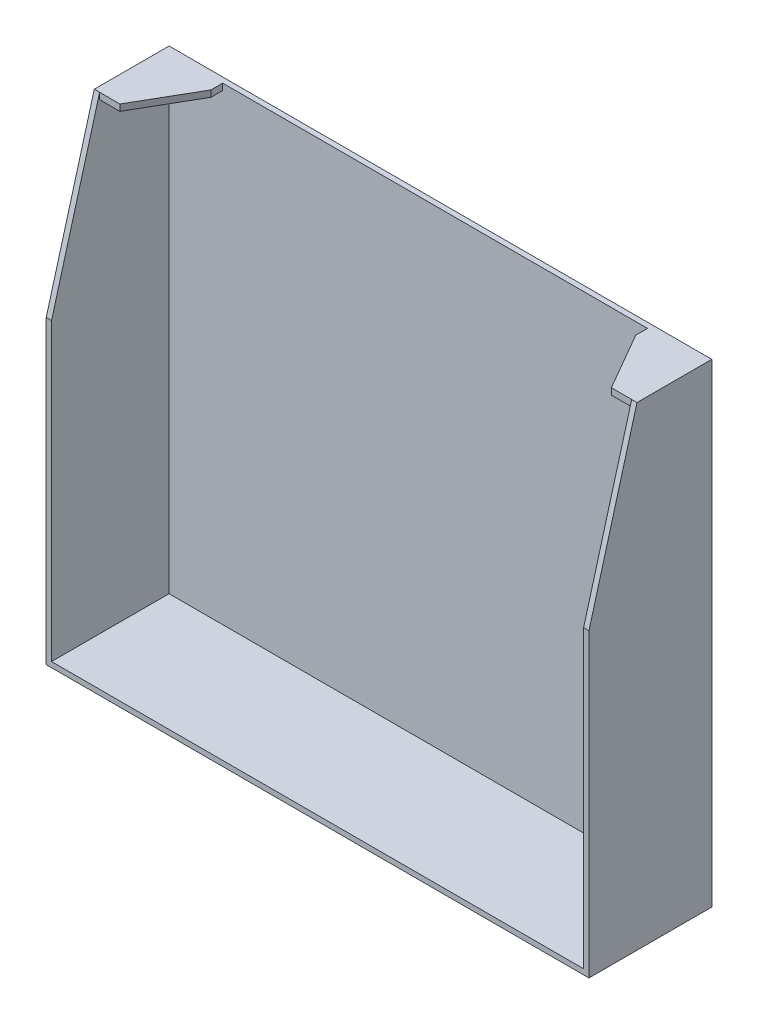
from build123d import *

# Parameters (mm, degrees)
SKETCH1_W              = 254
SKETCH1_H              = 222
BOSS_EXTRUDE1_DEPTH    = 2.5
BOSS_EXTRUDE2_DEPTH    = 55
HOLD_TAB_DEPTH         = 3
FRONT_TAPER_DEPTH      = 178.411949992
FRONT_TAPER_DEPTH_BACK = 178.411949992


with BuildPart() as part:
    # Sketch1 → Boss-Extrude1 (new body)
    with BuildSketch(Plane.XY):
        Rectangle(SKETCH1_W, SKETCH1_H)
    extrude(amount=-BOSS_EXTRUDE1_DEPTH)

    # Sketch2 → Boss-Extrude2 (add)
    with BuildSketch(Plane.XY):
        Polygon((-124.5, 111), (-127, 111), (-127, -111), (127, -111), (127, 111), (124.5, 111), (124.5, -108.5), (-124.5, -108.5), align=None)
    extrude(amount=BOSS_EXTRUDE2_DEPTH)

    # Sketch4 → Hold Tab (add)
    with BuildSketch(Plane(origin=(0, 111, 0), x_dir=(1, 0, 0), z_dir=(0, 1, 0))):
        Polygon((127, 2.5), (127, -32.5), (115, -32.5), (99.411542732, -5.5), (99.411542732, 2.5), align=None)
    hold_tab = extrude(amount=-HOLD_TAB_DEPTH)

    # Hold Tabs: Hold Tab across plane
    add(hold_tab.mirror(Plane(origin=(0, 0, 0), x_dir=(0, 0, 1), z_dir=(1, 0, 0))))

    # Sketch5 → Front Taper (cut, two sides: drawn at the far end of the back side and taken through both)
    with BuildSketch(Plane(origin=(0, 0, 0), x_dir=(0, 0, -1), z_dir=(1, 0, 0)).offset(-FRONT_TAPER_DEPTH_BACK)):
        Polygon((-55, 29.727996643), (-32.5, 111), (-55, 111), align=None)
    extrude(amount=FRONT_TAPER_DEPTH + FRONT_TAPER_DEPTH_BACK, mode=Mode.SUBTRACT)


solid = part.part
